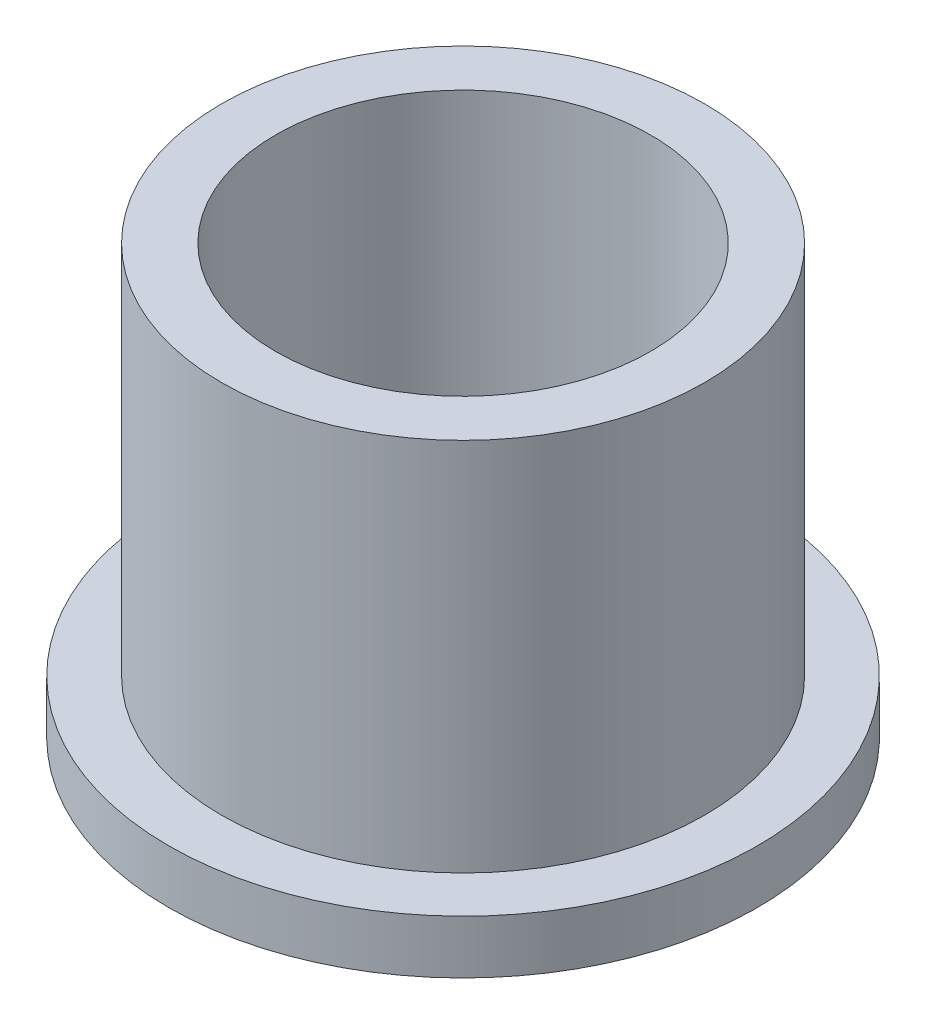
from build123d import *

# Parameters (mm, degrees)
SKETCH2_R           = 7.1628
SKETCH2_R_2         = 5.5626
BOSS_EXTRUDE1_DEPTH = 12.7
SKETCH3_R           = 8.73125
SKETCH3_R_2         = 7.1628
BOSS_EXTRUDE2_DEPTH = 1.5875


with BuildPart() as part:
    # Sketch2 → Boss-Extrude1 (new body)
    with BuildSketch(Plane(origin=(0, 0, 0), x_dir=(1, 0, 0), z_dir=(0, 1, 0))):
        Circle(SKETCH2_R)
        Circle(SKETCH2_R_2, mode=Mode.SUBTRACT)
    extrude(amount=BOSS_EXTRUDE1_DEPTH)

    # Sketch3 → Boss-Extrude2 (add)
    with BuildSketch(Plane(origin=(0, 0, 0), x_dir=(1, 0, 0), z_dir=(0, 1, 0))):
        Circle(SKETCH3_R)
        Circle(SKETCH3_R_2, mode=Mode.SUBTRACT)
    extrude(amount=BOSS_EXTRUDE2_DEPTH)


solid = part.part
